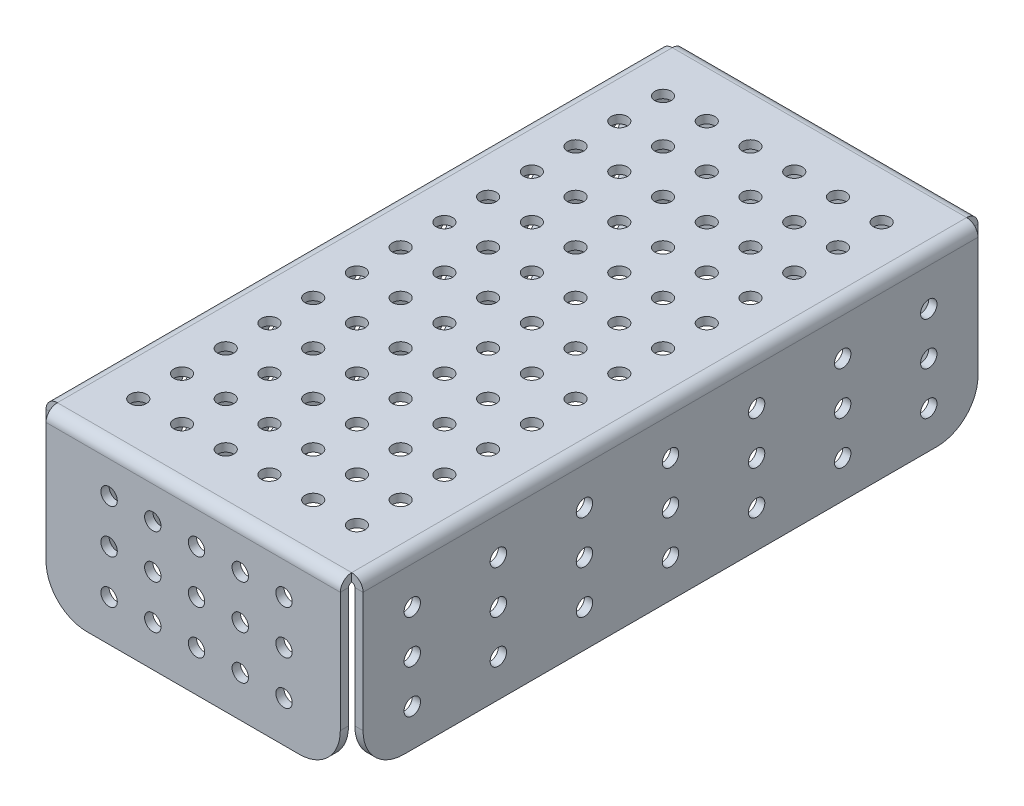
from build123d import *

# Parameters (mm, degrees)
BASE_FLANGE1_DEPTH            = 142.875
EDGE_FLANGE1_DEPTH            = 68.3768
EDGE_FLANGE1_BEND_DEPTH       = 68.3768
FILLET1_R                     = 9.525
SKETCH12_R                    = 1.905
CUT_EXTRUDE1_DEPTH            = 156.344551886
LPATTERN1_COUNT               = 6
LPATTERN1_PITCH               = 10.16
LPATTERN1_COUNT_DIR2          = 13
LPATTERN1_PITCH_DIR2          = 10.16
SKETCH13_R                    = 1.905
CUT_EXTRUDE2_DEPTH            = 158.349646098
LPATTERN2_COUNT               = 5
LPATTERN2_PITCH               = 10.16
LPATTERN2_COUNT_DIR2          = 3
LPATTERN2_PITCH_DIR2          = 10.16
SKETCH14_R                    = 1.905
CUT_EXTRUDE3_DEPTH            = 168.488765222
LPATTERN3_COUNT               = 2
LPATTERN3_PITCH               = 9.99998
LPATTERN3_COL_COUNT           = 2
LPATTERN3_COL_PITCH           = 9.99998
LPATTERN4_COUNT               = 4
LPATTERN4_PITCH               = 19.99996
LPATTERN4_COPY_1_SKETCH_R     = 1.905
LPATTERN4_COPY_1_DEPTH        = 168.488765222
LPATTERN4_COPY_2_SKETCH_R     = 1.905
LPATTERN4_COPY_2_DEPTH        = 168.488765222
LPATTERN4_COPY_3_SKETCH_R     = 1.905
LPATTERN4_COPY_3_DEPTH        = 168.488765222
LPATTERN4_COPY_4_SKETCH_R     = 1.905
LPATTERN4_COPY_4_DEPTH        = 168.488765222
LPATTERN4_COPY_5_SKETCH_R     = 1.905
LPATTERN4_COPY_5_DEPTH        = 168.488765222
LPATTERN4_COPY_6_SKETCH_R     = 1.905
LPATTERN4_COPY_6_DEPTH        = 168.488765222
LPATTERN4_COL_COUNT           = 4
LPATTERN4_COL_PITCH           = 19.99996
LPATTERN4_COL_COPY_1_SKETCH_R = 1.905
LPATTERN4_COL_COPY_1_DEPTH    = 168.488765222
LPATTERN4_COL_COPY_2_SKETCH_R = 1.905
LPATTERN4_COL_COPY_2_DEPTH    = 168.488765222
LPATTERN4_COL_COPY_3_SKETCH_R = 1.905
LPATTERN4_COL_COPY_3_DEPTH    = 168.488765222
LPATTERN4_COL_COPY_4_SKETCH_R = 1.905
LPATTERN4_COL_COPY_4_DEPTH    = 168.488765222
LPATTERN4_COL_COPY_5_SKETCH_R = 1.905
LPATTERN4_COL_COPY_5_DEPTH    = 168.488765222
LPATTERN4_COL_COPY_6_SKETCH_R = 1.905
LPATTERN4_COL_COPY_6_DEPTH    = 168.488765222


# Sheet-metal steps are written as plain solids
with BuildPart() as part:
    # Sketch1 → Base-Flange1 (new body)
    with BuildSketch(Plane.XY):
        with BuildLine():
            Line((-34.925, -38.1), (-34.925, -0.7366))
            ThreePointArc((-34.925, -0.7366), (-34.709254855, -0.215745145), (-34.1884, 0))
            Line((-34.1884, 0), (34.1884, 0))
            ThreePointArc((34.1884, 0), (34.709254855, -0.215745145), (34.925, -0.7366))
            Line((34.925, -0.7366), (34.925, -38.1))
            Line((34.925, -38.1), (36.83, -38.1))
            Line((36.83, -38.1), (36.83, -0.7366))
            ThreePointArc((36.83, -0.7366), (36.056293273, 1.131293273), (34.1884, 1.905))
            Line((34.1884, 1.905), (-34.1884, 1.905))
            ThreePointArc((-34.1884, 1.905), (-36.056293273, 1.131293273), (-36.83, -0.7366))
            Line((-36.83, -0.7366), (-36.83, -38.1))
            Line((-36.83, -38.1), (-34.925, -38.1))
        make_face()
    extrude(amount=BASE_FLANGE1_DEPTH)

    # Edge-Flange1 section (across the edge) → Edge-Flange1 (add)
    with BuildSketch(Plane(origin=(34.1884, 0, 143.6116), x_dir=(0, 0, -1), z_dir=(-1, 0, 0))):
        with BuildLine():
            Line((-1.905, 0.7366), (-1.905, 38.1))
            Line((-1.905, 38.1), (0, 38.1))
            Line((0, 38.1), (0, 0.7366))
            ThreePointArc((0, 0.7366), (0.215745145, 0.215745145), (0.7366, 0))
            Line((0.7366, 0), (0.7366, -1.905))
            ThreePointArc((0.7366, -1.905), (-1.131293273, -1.131293273), (-1.905, 0.7366))
        make_face()
    extrude(amount=EDGE_FLANGE1_DEPTH)

    # Edge-Flange1 section 2 (across the edge) → Edge-Flange1 bend (add)
    with BuildSketch(Plane(origin=(-34.1884, 0, -0.7366), x_dir=(0, 0, 1), z_dir=(1, 0, 0))):
        with BuildLine():
            Line((-1.905, 0.7366), (-1.905, 38.1))
            Line((-1.905, 38.1), (0, 38.1))
            Line((0, 38.1), (0, 0.7366))
            ThreePointArc((0, 0.7366), (0.215745145, 0.215745145), (0.7366, 0))
            Line((0.7366, 0), (0.7366, -1.905))
            ThreePointArc((0.7366, -1.905), (-1.131293273, -1.131293273), (-1.905, 0.7366))
        make_face()
    extrude(amount=EDGE_FLANGE1_BEND_DEPTH)

    # Fillet1
    fillet1_edges = [part.edges().sort_by_distance(p)[0] for p in [
        (35.8775, -38.1, 0),
        (-35.8775, -38.1, 0),
        (35.8775, -38.1, 142.875),
        (34.1884, -38.1, 144.5641),
        (-34.1884, -38.1, 144.5641),
        (-34.1884, -38.1, -1.6891),
        (34.1884, -38.1, -1.6891),
        (-35.8775, -38.1, 142.875),
    ]]
    fillet(fillet1_edges, radius=FILLET1_R)

    # Sketch12 → Cut-Extrude1 (cut, through all)
    with BuildSketch(Plane(origin=(0, 1.905, 0), x_dir=(1, 0, 0), z_dir=(0, 1, 0))):
        with Locations(Location((-25.5524, -132.715, 0), (0, 0, 270))):
            Circle(SKETCH12_R)
    cut_extrude1 = extrude(amount=-CUT_EXTRUDE1_DEPTH, mode=Mode.SUBTRACT)

    # LPattern1: Cut-Extrude1 6 × 13
    with Locations(*[(i * LPATTERN1_PITCH, 0, -j * LPATTERN1_PITCH_DIR2) for i in range(LPATTERN1_COUNT) for j in range(LPATTERN1_COUNT_DIR2) if (i, j) != (0, 0)]):
        add(cut_extrude1, mode=Mode.SUBTRACT)

    # Sketch13 → Cut-Extrude2 (cut, through all)
    with BuildSketch(Plane(origin=(0, 0, -2.6416), x_dir=(-1, 0, 0), z_dir=(0, 0, -1))):
        with Locations(Location((-21.1074, -8.2296, 0), (0, 0, 90))):
            Circle(SKETCH13_R)
    cut_extrude2 = extrude(amount=-CUT_EXTRUDE2_DEPTH, mode=Mode.SUBTRACT)

    # LPattern2: Cut-Extrude2 5 × 3
    with Locations(*[(-i * LPATTERN2_PITCH, -j * LPATTERN2_PITCH_DIR2, 0) for i in range(LPATTERN2_COUNT) for j in range(LPATTERN2_COUNT_DIR2) if (i, j) != (0, 0)]):
        add(cut_extrude2, mode=Mode.SUBTRACT)

    # Sketch14 → Cut-Extrude3 (cut, through all)
    with BuildSketch(Plane.ZY.offset(36.83)):
        with Locations(Location((71.4375, -19.4183, 0), (0, 0, 270))):
            Circle(SKETCH14_R)
    cut_extrude3 = extrude(amount=-CUT_EXTRUDE3_DEPTH, mode=Mode.SUBTRACT)

    # LPattern3: Cut-Extrude3 ×2
    with Locations(*[(0, i * LPATTERN3_PITCH, 0) for i in range(1, LPATTERN3_COUNT)]):
        add(cut_extrude3, mode=Mode.SUBTRACT)

    # LPattern3 col: Cut-Extrude3 ×2
    with Locations(*[(0, -i * LPATTERN3_COL_PITCH, 0) for i in range(1, LPATTERN3_COL_COUNT)]):
        add(cut_extrude3, mode=Mode.SUBTRACT)

    # LPattern4: Cut-Extrude3 ×4
    with Locations(*[(0, 0, i * LPATTERN4_PITCH) for i in range(1, LPATTERN4_COUNT)]):
        add(cut_extrude3, mode=Mode.SUBTRACT)

    # LPattern4 copy 1 sketch → LPattern4 copy 1 (cut, through all)
    with BuildSketch(Plane(origin=(-36.83, 9.99998, 19.99996), x_dir=(0, 0, 1), z_dir=(-1, 0, 0))):
        with Locations(Location((71.4375, -19.4183, 0), (0, 0, 270))):
            Circle(LPATTERN4_COPY_1_SKETCH_R)
    extrude(amount=-LPATTERN4_COPY_1_DEPTH, mode=Mode.SUBTRACT)

    # LPattern4 copy 2 sketch → LPattern4 copy 2 (cut, through all)
    with BuildSketch(Plane(origin=(-36.83, 9.99998, 39.99992), x_dir=(0, 0, 1), z_dir=(-1, 0, 0))):
        with Locations(Location((71.4375, -19.4183, 0), (0, 0, 270))):
            Circle(LPATTERN4_COPY_2_SKETCH_R)
    extrude(amount=-LPATTERN4_COPY_2_DEPTH, mode=Mode.SUBTRACT)

    # LPattern4 copy 3 sketch → LPattern4 copy 3 (cut, through all)
    with BuildSketch(Plane(origin=(-36.83, 9.99998, 59.99988), x_dir=(0, 0, 1), z_dir=(-1, 0, 0))):
        with Locations(Location((71.4375, -19.4183, 0), (0, 0, 270))):
            Circle(LPATTERN4_COPY_3_SKETCH_R)
    extrude(amount=-LPATTERN4_COPY_3_DEPTH, mode=Mode.SUBTRACT)

    # LPattern4 copy 4 sketch → LPattern4 copy 4 (cut, through all)
    with BuildSketch(Plane(origin=(-36.83, -9.99998, 19.99996), x_dir=(0, 0, 1), z_dir=(-1, 0, 0))):
        with Locations(Location((71.4375, -19.4183, 0), (0, 0, 270))):
            Circle(LPATTERN4_COPY_4_SKETCH_R)
    extrude(amount=-LPATTERN4_COPY_4_DEPTH, mode=Mode.SUBTRACT)

    # LPattern4 copy 5 sketch → LPattern4 copy 5 (cut, through all)
    with BuildSketch(Plane(origin=(-36.83, -9.99998, 39.99992), x_dir=(0, 0, 1), z_dir=(-1, 0, 0))):
        with Locations(Location((71.4375, -19.4183, 0), (0, 0, 270))):
            Circle(LPATTERN4_COPY_5_SKETCH_R)
    extrude(amount=-LPATTERN4_COPY_5_DEPTH, mode=Mode.SUBTRACT)

    # LPattern4 copy 6 sketch → LPattern4 copy 6 (cut, through all)
    with BuildSketch(Plane(origin=(-36.83, -9.99998, 59.99988), x_dir=(0, 0, 1), z_dir=(-1, 0, 0))):
        with Locations(Location((71.4375, -19.4183, 0), (0, 0, 270))):
            Circle(LPATTERN4_COPY_6_SKETCH_R)
    extrude(amount=-LPATTERN4_COPY_6_DEPTH, mode=Mode.SUBTRACT)

    # LPattern4 col: Cut-Extrude3 ×4
    with Locations(*[(0, 0, -i * LPATTERN4_COL_PITCH) for i in range(1, LPATTERN4_COL_COUNT)]):
        add(cut_extrude3, mode=Mode.SUBTRACT)

    # LPattern4 col copy 1 sketch → LPattern4 col copy 1 (cut, through all)
    with BuildSketch(Plane(origin=(-36.83, 9.99998, -19.99996), x_dir=(0, 0, 1), z_dir=(-1, 0, 0))):
        with Locations(Location((71.4375, -19.4183, 0), (0, 0, 270))):
            Circle(LPATTERN4_COL_COPY_1_SKETCH_R)
    extrude(amount=-LPATTERN4_COL_COPY_1_DEPTH, mode=Mode.SUBTRACT)

    # LPattern4 col copy 2 sketch → LPattern4 col copy 2 (cut, through all)
    with BuildSketch(Plane(origin=(-36.83, 9.99998, -39.99992), x_dir=(0, 0, 1), z_dir=(-1, 0, 0))):
        with Locations(Location((71.4375, -19.4183, 0), (0, 0, 270))):
            Circle(LPATTERN4_COL_COPY_2_SKETCH_R)
    extrude(amount=-LPATTERN4_COL_COPY_2_DEPTH, mode=Mode.SUBTRACT)

    # LPattern4 col copy 3 sketch → LPattern4 col copy 3 (cut, through all)
    with BuildSketch(Plane(origin=(-36.83, 9.99998, -59.99988), x_dir=(0, 0, 1), z_dir=(-1, 0, 0))):
        with Locations(Location((71.4375, -19.4183, 0), (0, 0, 270))):
            Circle(LPATTERN4_COL_COPY_3_SKETCH_R)
    extrude(amount=-LPATTERN4_COL_COPY_3_DEPTH, mode=Mode.SUBTRACT)

    # LPattern4 col copy 4 sketch → LPattern4 col copy 4 (cut, through all)
    with BuildSketch(Plane(origin=(-36.83, -9.99998, -19.99996), x_dir=(0, 0, 1), z_dir=(-1, 0, 0))):
        with Locations(Location((71.4375, -19.4183, 0), (0, 0, 270))):
            Circle(LPATTERN4_COL_COPY_4_SKETCH_R)
    extrude(amount=-LPATTERN4_COL_COPY_4_DEPTH, mode=Mode.SUBTRACT)

    # LPattern4 col copy 5 sketch → LPattern4 col copy 5 (cut, through all)
    with BuildSketch(Plane(origin=(-36.83, -9.99998, -39.99992), x_dir=(0, 0, 1), z_dir=(-1, 0, 0))):
        with Locations(Location((71.4375, -19.4183, 0), (0, 0, 270))):
            Circle(LPATTERN4_COL_COPY_5_SKETCH_R)
    extrude(amount=-LPATTERN4_COL_COPY_5_DEPTH, mode=Mode.SUBTRACT)

    # LPattern4 col copy 6 sketch → LPattern4 col copy 6 (cut, through all)
    with BuildSketch(Plane(origin=(-36.83, -9.99998, -59.99988), x_dir=(0, 0, 1), z_dir=(-1, 0, 0))):
        with Locations(Location((71.4375, -19.4183, 0), (0, 0, 270))):
            Circle(LPATTERN4_COL_COPY_6_SKETCH_R)
    extrude(amount=-LPATTERN4_COL_COPY_6_DEPTH, mode=Mode.SUBTRACT)


solid = part.part
